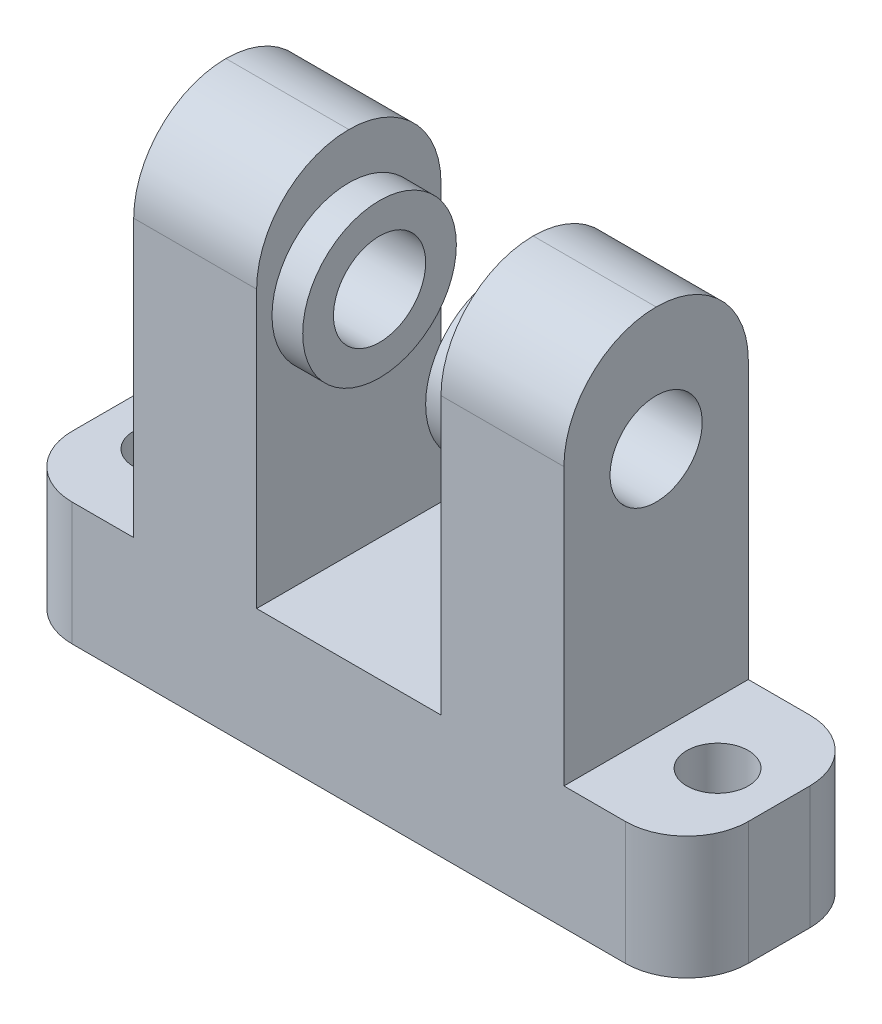
from build123d import *
from build123d.topology import SkipClean

# Parameters (mm, degrees)
SKETCH2_W               = 14
SKETCH2_H               = 6
BOSS_EXTRUDE1_DEPTH     = 4
SKETCH3_W               = 4
SKETCH3_H               = 6
BOSS_EXTRUDE2_DEPTH     = 12
CUT_EXTRUDE1_DEPTH      = 22.470910554
CUT_EXTRUDE1_DEPTH_BACK = 22.470910554
SKETCH4_R               = 1.5
BOSS_EXTRUDE3_START     = 1
SKETCH5_R               = 2.5
SKETCH5_R_2             = 1.5
BOSS_EXTRUDE3_DEPTH     = 1
SKETCH6_R               = 2.5
SKETCH6_R_2             = 1.5
BOSS_EXTRUDE4_DEPTH     = 1
SKETCH7_W               = 4
SKETCH7_H               = 6
SKETCH7_R               = 1
BOSS_EXTRUDE5_DEPTH     = 4
FILLET1_R               = 2
FILLET2_R               = 3


with BuildPart() as part:
    # Sketch2 → Boss-Extrude1 (new body)
    with BuildSketch(Plane(origin=(0, 0, 0), x_dir=(1, 0, 0), z_dir=(0, 1, 0))):
        Rectangle(SKETCH2_W, SKETCH2_H)
    extrude(amount=BOSS_EXTRUDE1_DEPTH)

    # Sketch3 → Boss-Extrude2 (add)
    with BuildSketch(Plane(origin=(0, 4, 0), x_dir=(1, 0, 0), z_dir=(0, 1, 0))):
        with Locations((-5, 0)):
            Rectangle(SKETCH3_W, SKETCH3_H)
        with Locations((5, 0)):
            Rectangle(SKETCH3_W, SKETCH3_H)
    extrude(amount=BOSS_EXTRUDE2_DEPTH)

    # Sketch4 → Cut-Extrude1 (cut, two sides: drawn at the far end of the back side and taken through both)
    with BuildSketch(Plane(origin=(7, 0, 0), x_dir=(0, 0, -1), z_dir=(1, 0, 0)).offset(-CUT_EXTRUDE1_DEPTH_BACK)):
        with Locations((0, 12)):
            Circle(SKETCH4_R)
    extrude(amount=CUT_EXTRUDE1_DEPTH + CUT_EXTRUDE1_DEPTH_BACK, mode=Mode.SUBTRACT)

    # Sketch5 → Boss-Extrude3 (add)
    with BuildSketch(Plane(origin=(-3, 0, 0), x_dir=(0, 0, -1), z_dir=(1, 0, 0)).offset(BOSS_EXTRUDE3_START)):
        with Locations(Location((0, 12, 0), (0, 0, 180))):
            Circle(SKETCH5_R)
        with Locations((0, 12)):
            Circle(SKETCH5_R_2, mode=Mode.SUBTRACT)
    extrude(amount=-BOSS_EXTRUDE3_DEPTH)

    # Sketch6 → Boss-Extrude4 (add)
    with SkipClean():  # the faces are left unmerged after this step: merging them gives an invalid solid
        with BuildSketch(Plane.ZY.offset(-3)):
            with Locations((0, 12)):
                Circle(SKETCH6_R)
            with Locations((0, 12)):
                Circle(SKETCH6_R_2, mode=Mode.SUBTRACT)
        extrude(amount=BOSS_EXTRUDE4_DEPTH)

    # Sketch7 → Boss-Extrude5 (add)
    # profile 1 of 2: a face of its own
    with SkipClean():  # the faces are left unmerged after this step: merging them gives an invalid solid
        with BuildSketch(Plane(origin=(0, 4, 0), x_dir=(1, 0, 0), z_dir=(0, 1, 0))):
            with Locations((9, 0)):
                Rectangle(SKETCH7_W, SKETCH7_H)
            with Locations(Location((9, 0, 0), (0, 0, 270))):
                Circle(SKETCH7_R, mode=Mode.SUBTRACT)
        # profile 2 of 2: a face of its own
        with BuildSketch(Plane(origin=(0, 4, 0), x_dir=(1, 0, 0), z_dir=(0, 1, 0))):
            with Locations((-9, 0)):
                Rectangle(SKETCH7_W, SKETCH7_H)
            with Locations(Location((-9, 0, 0), (0, 0, 270))):
                Circle(SKETCH7_R, mode=Mode.SUBTRACT)
        extrude(amount=-BOSS_EXTRUDE5_DEPTH)

    # Fillet1
    fillet1_edges = [part.edges().sort_by_distance(p)[0] for p in [
        (11, 2, -3),
        (11, 2, 3),
        (-11, 2, 3),
        (-11, 2, -3),
    ]]
    fillet(fillet1_edges, radius=FILLET1_R)

    # Fillet2
    fillet2_edges = [part.edges().sort_by_distance(p)[0] for p in [
        (-5, 16, -3),
        (5, 16, -3),
        (5, 16, 3),
        (-5, 16, 3),
    ]]
    fillet(fillet2_edges, radius=FILLET2_R - 0.0001)  # a hair under: the kernel refuses the full size


solid = part.part
